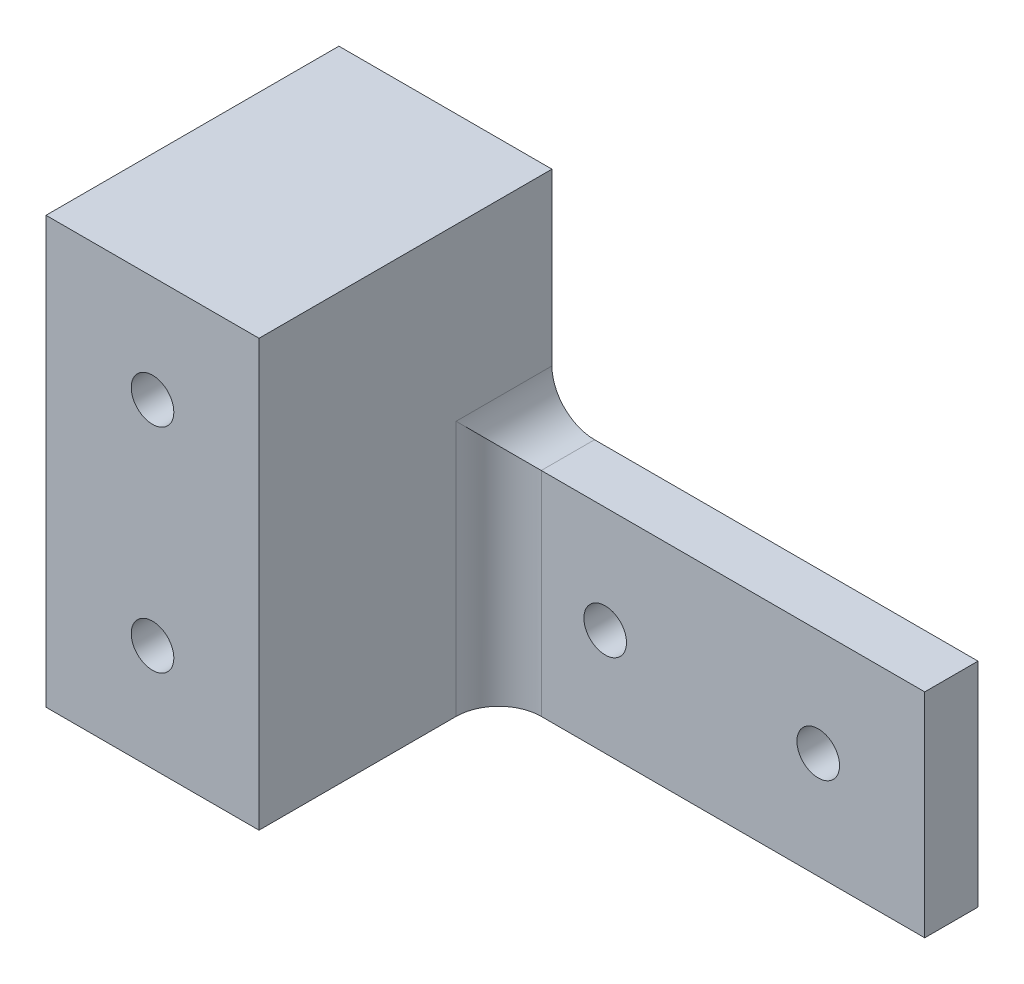
from build123d import *

# Parameters (mm, degrees)
BOSS_EXTRUDE1_DEPTH = 34.925
SKETCH2_R           = 2.54
CUT_EXTRUDE1_DEPTH  = 99.014466407
SKETCH4_W           = 50.8
SKETCH4_H           = 28.575
CUT_EXTRUDE3_DEPTH  = 99.014466407
FILLET1_R           = 5.08
SKETCH5_R           = 4.445
CUT_EXTRUDE4_DEPTH  = 22.225


with BuildPart() as part:
    # Sketch1 → Boss-Extrude1 (new body)
    with BuildSketch(Plane.XY):
        Polygon((0, 0), (0, 50.8), (25.4, 50.8), (25.4, 25.4), (76.2, 25.4), (76.2, 0), align=None)
    extrude(amount=BOSS_EXTRUDE1_DEPTH)

    # Sketch2 → Cut-Extrude1 (cut, through all)
    with BuildSketch(Plane.XY.offset(34.925)):
        with Locations((12.7, 38.1)):
            Circle(SKETCH2_R)
        with Locations((12.7, 12.7)):
            Circle(SKETCH2_R)
        with Locations((38.1, 12.7)):
            Circle(SKETCH2_R)
        with Locations((63.5, 12.7)):
            Circle(SKETCH2_R)
    extrude(amount=-CUT_EXTRUDE1_DEPTH, mode=Mode.SUBTRACT)

    # Sketch4 → Cut-Extrude3 (cut, through all)
    with BuildSketch(Plane.XZ):
        with Locations((50.8, 20.6375)):
            Rectangle(SKETCH4_W, SKETCH4_H)
    extrude(amount=-CUT_EXTRUDE3_DEPTH, mode=Mode.SUBTRACT)

    # Fillet1
    fillet1_edges = [part.edges().sort_by_distance(p)[0] for p in [
        (25.4, 25.4, 3.175),
        (25.4, 12.7, 6.35),
    ]]
    fillet(fillet1_edges, radius=FILLET1_R)

    # Sketch5 → Cut-Extrude4 (cut)
    with BuildSketch(Plane(origin=(0, 0, 0), x_dir=(-1, 0, 0), z_dir=(0, 0, -1))):
        with Locations((-12.7, 38.1)):
            Circle(SKETCH5_R)
    extrude(amount=-CUT_EXTRUDE4_DEPTH, mode=Mode.SUBTRACT)


solid = part.part
